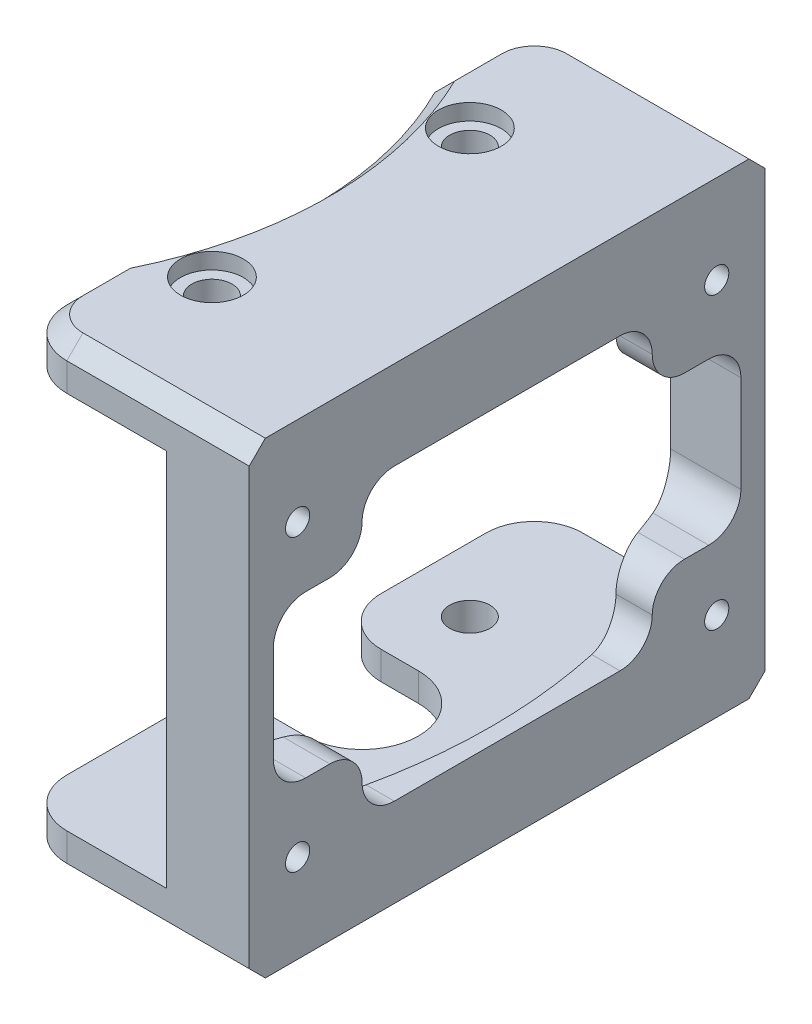
from build123d import *

# Parameters (mm, degrees)
SKETCH_1_W          = 14.314561435
SKETCH_1_H          = 32
SKETCH_1_R          = 1.25
EXTRUDE_1_DEPTH     = 14.5
SKETCH_2_R          = 33
CUT_EXTRUDE_1_DEPTH = 11.75
SKETCH_3_R          = 0.75
CUT_EXTRUDE_2_DEPTH = 26.906691589
CUT_EXTRUDE_3_REACH = 49.466
SKETCH_4_R          = 3.5
CUT_EXTRUDE_5_REACH = 49.466
SKETCH_6_R          = 22
SKETCH_7_W          = 29
SKETCH_7_H          = 10
CUT_EXTRUDE_6_DEPTH = 26.906691651
FILLET_1_R          = 3
FILLET_3_R          = 2
CHAMFER_2_SIZE      = 1
SKETCH_5_R          = 1.95
CUT_EXTRUDE_4_DEPTH = 1


with BuildPart() as part:
    # Эскиз1 → Бобышка-Вытянуть1 (new, symmetric)
    with BuildSketch(Plane(origin=(0, 0, 0), x_dir=(1, 0, 0), z_dir=(0, 1, 0))):
        with Locations((26.842719282, 0)):
            Rectangle(SKETCH_1_W, SKETCH_1_H)
        with Locations(Location((23.685438565, 8, 0), (0, 0, 90))):
            Circle(SKETCH_1_R, mode=Mode.SUBTRACT)
        with Locations(Location((23.685438565, -8, 0), (0, 0, 90))):
            Circle(SKETCH_1_R, mode=Mode.SUBTRACT)
    extrude(amount=EXTRUDE_1_DEPTH, both=True)

    # Эскиз2 → Вырез-Вытянуть1 (cut, symmetric)
    with BuildSketch(Plane(origin=(0, 0, 0), x_dir=(1, 0, 0), z_dir=(0, 1, 0))):
        Circle(SKETCH_2_R)
    extrude(amount=CUT_EXTRUDE_1_DEPTH, both=True, mode=Mode.SUBTRACT)

    # Эскиз3 → Вырез-Вытянуть2 (cut, through all)
    with BuildSketch(Plane(origin=(34, 0, 0), x_dir=(0, 0, -1), z_dir=(1, 0, 0))):
        with Locations((-13, 9)):
            Circle(SKETCH_3_R)
        with Locations((-13, -9)):
            Circle(SKETCH_3_R)
        with Locations((13, 9)):
            Circle(SKETCH_3_R)
        with Locations((13, -9)):
            Circle(SKETCH_3_R)
        Polygon((-13, 5), (-9, 5), (-9, 9), (9, 9), (9, 5), (13, 5), (13, -5), (9, -5), (9, -9), (-9, -9), (-9, -5), (-13, -5), align=None)
    extrude(amount=-CUT_EXTRUDE_2_DEPTH, mode=Mode.SUBTRACT)

    # Эскиз4 → Вырез-Вытянуть3 (cut, up to next)
    with BuildSketch(Plane.XZ.offset(14.5), mode=Mode.PRIVATE) as cut_extrude_3_sk1:
        with BuildLine():
            ThreePointArc((25, -3.5), (21.5, 0), (25, 3.5))
            Line((25, 3.5), (19.685438565, 3.5))
            Line((19.685438565, 3.5), (19.685438565, -3.5))
            Line((19.685438565, -3.5), (25, -3.5))
        make_face()
    cut_extrude_3_tool1 = extrude(cut_extrude_3_sk1.sketch, amount=-CUT_EXTRUDE_3_REACH, mode=Mode.PRIVATE) & part.part
    # Эскиз4 → Вырез-Вытянуть3 (cut, up to next)
    with BuildSketch(Plane.XZ.offset(14.5), mode=Mode.PRIVATE) as cut_extrude_3_sk2:
        with Locations((25, 0)):
            Circle(SKETCH_4_R)
    cut_extrude_3_tool2 = extrude(cut_extrude_3_sk2.sketch, amount=-CUT_EXTRUDE_3_REACH, mode=Mode.PRIVATE) & part.part
    add(cut_extrude_3_tool1.solids().sort_by_distance((21.087199, -14.5, 0))[0], mode=Mode.SUBTRACT)
    add(cut_extrude_3_tool2.solids().sort_by_distance((25, -14.5, 0))[0], mode=Mode.SUBTRACT)

    # Эскиз6 → Вырез-Вытянуть5 (cut, up to next)
    with BuildSketch(Plane(origin=(0, 14.5, 0), x_dir=(1, 0, 0), z_dir=(0, 1, 0)), mode=Mode.PRIVATE) as cut_extrude_5_sk1:
        Circle(SKETCH_6_R)
    cut_extrude_5_tool1 = extrude(cut_extrude_5_sk1.sketch, amount=-CUT_EXTRUDE_5_REACH, mode=Mode.PRIVATE) & part.part
    add(cut_extrude_5_tool1.solids().sort_by_distance((0, 14.5, 0))[0], mode=Mode.SUBTRACT)

    # Эскиз7 → Вырез-Вытянуть6 (cut, through all)
    with BuildSketch(Plane(origin=(34, 0, 0), x_dir=(0, 0, -1), z_dir=(1, 0, 0))):
        Rectangle(SKETCH_7_W, SKETCH_7_H)
    extrude(amount=-CUT_EXTRUDE_6_DEPTH, mode=Mode.SUBTRACT)

    # Скругление1
    fillet_1_edges = [part.edges().sort_by_distance(p)[0] for p in [
        (19.685438565, -13.125, -3.5),
        (19.685438565, -13.125, 3.5),
        (19.685438565, -13.125, 16),
        (19.685438565, -13.125, -16),
        (19.685438565, 13.125, 16),
        (19.685438565, 13.125, -16),
    ]]
    fillet(fillet_1_edges, radius=FILLET_1_R)

    # Скругление3
    fillet_3_edges = [part.edges().sort_by_distance(p)[0] for p in [
        (32.874507866, -5, 9),
        (32.874507866, -9, 9),
        (32.874507866, -9, -9),
        (32.874507866, -5, -9),
        (32.874507866, 5, -9),
        (32.874507866, 9, -9),
        (32.874507866, 9, 9),
        (32.874507866, 5, 9),
        (31.821858858, 5, -14.5),
        (31.821858858, -5, -14.5),
        (31.821858858, -5, 14.5),
        (31.821858858, 5, 14.5),
    ]]
    fillet(fillet_3_edges, radius=FILLET_3_R - 0.0001)  # a hair under: the kernel refuses the full size

    # Фаска2
    chamfer_2_edges = [part.edges().sort_by_distance(p)[0] for p in [
        (23.842719282, -14.5, -3.5),
        (28.5, -14.5, 0),
        (23.842719282, -14.5, 3.5),
        (19.685438565, 14.5, 11.411300961),
        (22, 14.5, 0),
        (19.685438565, -14.5, 9.75),
        (19.685438565, -14.5, -9.75),
        (28.342719282, -14.5, 16),
        (20.564118221, -14.5, 15.121320344),
        (20.564118221, -14.5, -15.121320344),
        (20.564118221, -14.5, -4.378679656),
        (20.564118221, -14.5, 4.378679656),
        (19.685438565, 14.5, -11.411300961),
        (28.342719282, 14.5, 16),
        (20.564118221, 14.5, 15.121320344),
        (20.564118221, 14.5, -15.121320344),
        (28.342719282, -14.5, -16),
        (28.342719282, 14.5, -16),
    ]]
    chamfer(chamfer_2_edges, length=CHAMFER_2_SIZE)

    # Эскиз5 → Вырез-Вытянуть4 (cut)
    with BuildSketch(Plane(origin=(0, 14.5, 0), x_dir=(1, 0, 0), z_dir=(0, 1, 0))):
        with Locations(Location((23.685438565, 8, 0), (0, 0, 270))):
            Circle(SKETCH_5_R)
        with Locations(Location((23.685438565, -8, 0), (0, 0, 270))):
            Circle(SKETCH_5_R)
    cut_extrude_4 = extrude(amount=-CUT_EXTRUDE_4_DEPTH, mode=Mode.SUBTRACT)

    # Зеркальное отражение1: Вырез-Вытянуть4 across plane
    add(cut_extrude_4.mirror(Plane.ZX), mode=Mode.SUBTRACT)


solid = part.part
